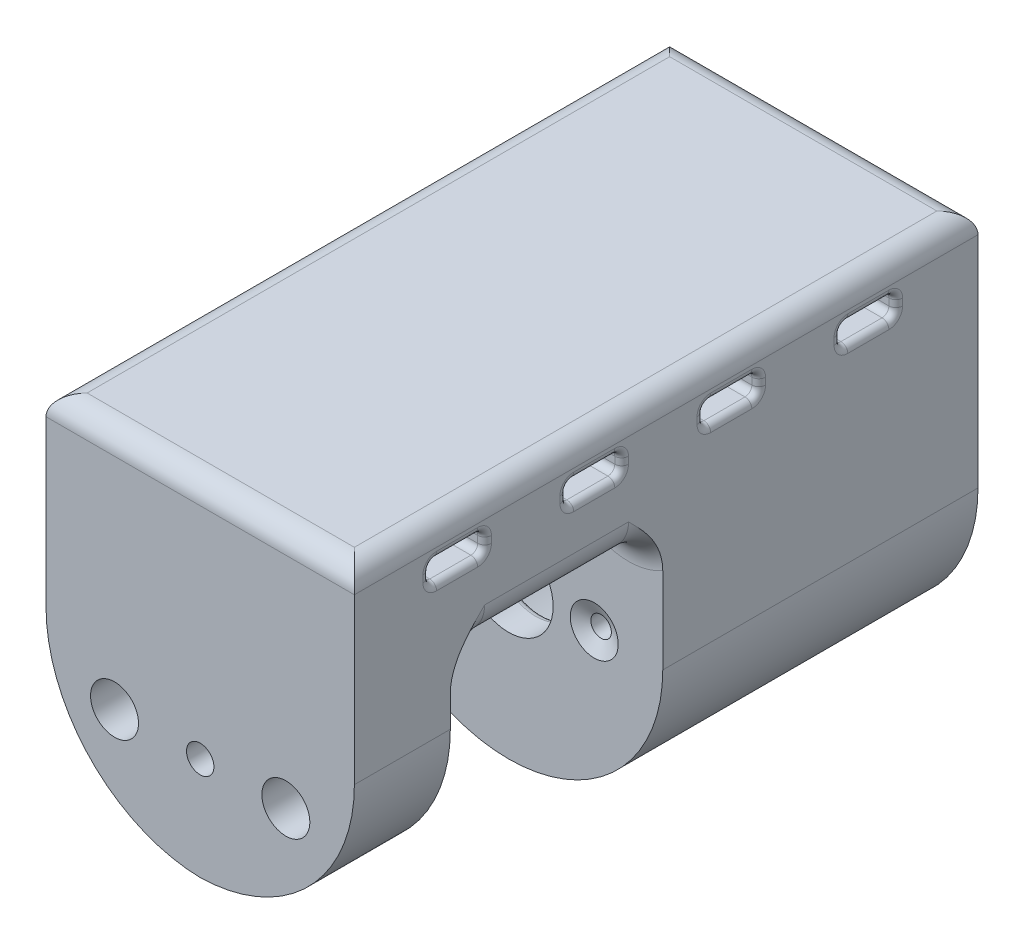
from build123d import *

# Parameters (mm, degrees)
SZKIC1_R                         = 22.5
DODANIE_WYCI_GNI_CIE1_DEPTH      = 5
WYTNIJ_WYCI_GNI_CIE1_REACH       = 34.21
SZKIC2_R                         = 6.5
SZKIC2_R_2                       = 1.5
SFAZOWANIE1_SIZE                 = 2
SFAZOWANIE1_SIZE2                = 1
DODANIE_WYCI_GNI_CIE2_START      = 41
SZKIC4_R                         = 22.5
SZKIC4_R_2                       = 18.7
DODANIE_WYCI_GNI_CIE2_DEPTH      = 41
ZAOKR_GLENIE1_R                  = 1
ZAOKR_GLENIE2_R                  = 1
DODANIE_WYCI_GNI_CIE3_REACH      = 76.118
DODANIE_WYCI_GNI_CIE3_END_RADIUS = 22.5
SZKIC5_W                         = 45
SZKIC5_H                         = 46
DODANIE_WYCI_GNI_CIE4_DEPTH      = 45
SZKIC8_W                         = 45
SZKIC8_H                         = 14
DODANIE_WYCI_GNI_CIE5_DEPTH      = 50
SZKIC10_R                        = 4
WYTNIJ_WYCI_GNI_CIE3_DEPTH       = 10
WYTNIJ_WYCI_GNI_CIE4_REACH       = 98.438
SZKIC11_R                        = 2
ZAOKR_GLENIE5_R                  = 23
ZAOKR_GLENIE6_R                  = 5
WYTNIJ_WYCI_GNI_CIE5_REACH       = 77.829
ZAOKR_GLENIE7_R                  = 1
ZAOKR_GLENIE8_R                  = 3
WYTNIJ_WYCI_GNI_CIE6_REACH       = 102.061
SZKIC13_R                        = 3.5


with BuildPart() as part:
    # Szkic1 → Dodanie-wyciągnięcie1 (new body)
    with BuildSketch(Plane.XY):
        Circle(SZKIC1_R)
    extrude(amount=DODANIE_WYCI_GNI_CIE1_DEPTH)

    # Szkic2 → Wytnij-wyciągnięcie1 (cut, up to next)
    with BuildSketch(Plane.XY.offset(5), mode=Mode.PRIVATE) as wytnij_wyci_gni_cie1_sk1:
        Circle(SZKIC2_R)
    wytnij_wyci_gni_cie1_tool1 = extrude(wytnij_wyci_gni_cie1_sk1.sketch, amount=-WYTNIJ_WYCI_GNI_CIE1_REACH, mode=Mode.PRIVATE) & part.part
    # Szkic2 → Wytnij-wyciągnięcie1 (cut, up to next)
    with BuildSketch(Plane.XY.offset(5), mode=Mode.PRIVATE) as wytnij_wyci_gni_cie1_sk2:
        with Locations((12.5, 0)):
            Circle(SZKIC2_R_2)
    wytnij_wyci_gni_cie1_tool2 = extrude(wytnij_wyci_gni_cie1_sk2.sketch, amount=-WYTNIJ_WYCI_GNI_CIE1_REACH, mode=Mode.PRIVATE) & part.part
    # Szkic2 → Wytnij-wyciągnięcie1 (cut, up to next)
    with BuildSketch(Plane.XY.offset(5), mode=Mode.PRIVATE) as wytnij_wyci_gni_cie1_sk3:
        with Locations((-12.5, 0)):
            Circle(SZKIC2_R_2)
    wytnij_wyci_gni_cie1_tool3 = extrude(wytnij_wyci_gni_cie1_sk3.sketch, amount=-WYTNIJ_WYCI_GNI_CIE1_REACH, mode=Mode.PRIVATE) & part.part
    add(wytnij_wyci_gni_cie1_tool1.solids().sort_by_distance((0, 0, 5))[0], mode=Mode.SUBTRACT)
    add(wytnij_wyci_gni_cie1_tool2.solids().sort_by_distance((12.5, 0, 5))[0], mode=Mode.SUBTRACT)
    add(wytnij_wyci_gni_cie1_tool3.solids().sort_by_distance((-12.5, 0, 5))[0], mode=Mode.SUBTRACT)

    # Sfazowanie1
    sfazowanie1_edges = [part.edges().sort_by_distance(p)[0] for p in [
        (11, 0, 5),
        (-14, 0, 5),
    ]]
    sfazowanie1_side = [part.faces().sort_by_distance(p)[0] for p in [
        (-21.863603897, 0, 5),
    ]]
    chamfer(sfazowanie1_edges, length=SFAZOWANIE1_SIZE, length2=SFAZOWANIE1_SIZE2, reference=sfazowanie1_side[0])

    # Szkic4 → Dodanie-wyciągnięcie2 (add)
    with BuildSketch(Plane(origin=(0, 0, 0), x_dir=(-1, 0, 0), z_dir=(0, 0, -1)).offset(DODANIE_WYCI_GNI_CIE2_START)):
        Circle(SZKIC4_R)
        Circle(SZKIC4_R_2, mode=Mode.SUBTRACT)
    extrude(amount=-DODANIE_WYCI_GNI_CIE2_DEPTH)

    # Zaokrąglenie1
    zaokr_glenie1_edges = [part.edges().sort_by_distance(p)[0] for p in [
        (18.7, 0, 0),
    ]]
    fillet(zaokr_glenie1_edges, radius=ZAOKR_GLENIE1_R)

    # Zaokrąglenie2
    zaokr_glenie2_edges = [part.edges().sort_by_distance(p)[0] for p in [
        (-6.5, 0, 0),
    ]]
    fillet(zaokr_glenie2_edges, radius=ZAOKR_GLENIE2_R)

    # Dodanie-wyciągnięcie3: up to this cylinder (the profile starts outside it)
    dodanie_wyci_gni_cie3_end = Plane(origin=(0, 0, -18), z_dir=(0, 0, -1)) * Cylinder(DODANIE_WYCI_GNI_CIE3_END_RADIUS, 198.236, mode=Mode.PRIVATE)
    # Szkic5 → Dodanie-wyciągnięcie3 (add, up to the surface)
    with BuildSketch(Plane(origin=(0, 35, 0), x_dir=(1, 0, 0), z_dir=(0, 1, 0)), mode=Mode.PRIVATE) as dodanie_wyci_gni_cie3_sk1:
        with Locations((0, 18)):
            Rectangle(SZKIC5_W, SZKIC5_H)
    dodanie_wyci_gni_cie3_tool1 = extrude(dodanie_wyci_gni_cie3_sk1.sketch, amount=-DODANIE_WYCI_GNI_CIE3_REACH, mode=Mode.PRIVATE) - dodanie_wyci_gni_cie3_end
    add(dodanie_wyci_gni_cie3_tool1.solids().sort_by_distance((0, 35, -18))[0])

    # Szkic7 → Dodanie-wyciągnięcie4 (add)
    with BuildSketch(Plane.XY.offset(5)):
        with BuildLine():
            Line((-22.5, 21.213203436), (-22.5, 35))
            Line((-22.5, 35), (22.5, 35))
            Line((22.5, 35), (22.5, 21.213203436))
            ThreePointArc((22.5, 21.213203436), (19.632007164, 16.690533267), (14.318181818, 17.356257356))
            ThreePointArc((14.318181818, 17.356257356), (0, 22.5), (-14.318181818, 17.356257356))
            ThreePointArc((-14.318181818, 17.356257356), (-19.632007164, 16.690533267), (-22.5, 21.213203436))
        make_face()
    extrude(amount=DODANIE_WYCI_GNI_CIE4_DEPTH)

    # Szkic8 → Dodanie-wyciągnięcie5 (add)
    with BuildSketch(Plane(origin=(0, 35, 0), x_dir=(1, 0, 0), z_dir=(0, 1, 0))):
        with Locations((0, -43)):
            Rectangle(SZKIC8_W, SZKIC8_H)
    extrude(amount=-DODANIE_WYCI_GNI_CIE5_DEPTH)

    # Szkic10 → Wytnij-wyciągnięcie3 (cut)
    with BuildSketch(Plane(origin=(0, 0, 36), x_dir=(-1, 0, 0), z_dir=(0, 0, -1))):
        Circle(SZKIC10_R)
    extrude(amount=-WYTNIJ_WYCI_GNI_CIE3_DEPTH, mode=Mode.SUBTRACT)

    # Szkic11 → Wytnij-wyciągnięcie4 (cut, up to next)
    with BuildSketch(Plane(origin=(0, 0, 46), x_dir=(-1, 0, 0), z_dir=(0, 0, -1)), mode=Mode.PRIVATE) as wytnij_wyci_gni_cie4_sk1:
        Circle(SZKIC11_R)
    wytnij_wyci_gni_cie4_tool1 = extrude(wytnij_wyci_gni_cie4_sk1.sketch, amount=-WYTNIJ_WYCI_GNI_CIE4_REACH, mode=Mode.PRIVATE) & part.part
    add(wytnij_wyci_gni_cie4_tool1.solids().sort_by_distance((0, 0, 46))[0], mode=Mode.SUBTRACT)

    # Zaokrąglenie5
    # the kernel refuses this fillet: 23 mm, written as the material it takes off along each edge
    with BuildSketch(Plane(origin=(-22.5, -15, 36), x_dir=(0, 1, 0), z_dir=(0, 0, 1)), Plane(origin=(22.5, -15, 107.5), x_dir=(0, 1, 0), z_dir=(0, 0, -1))) as zaokr_glenie5_piece_1:
        with BuildLine():
            CenterArc((ZAOKR_GLENIE5_R, -ZAOKR_GLENIE5_R), ZAOKR_GLENIE5_R, 90, 90)
            Line((0, -ZAOKR_GLENIE5_R), (0, 0))
            Line((0, 0), (ZAOKR_GLENIE5_R, 0))
        make_face()
    extrude(amount=71.5, mode=Mode.SUBTRACT)

    # Zaokrąglenie6
    # the kernel refuses this fillet: 5 mm, written as the material it adds along each edge
    with BuildSketch(Plane(origin=(-17.5, 21.213203436, 5), x_dir=(0.6363636363636366, -0.7713892158398699, 0), z_dir=(0.7713892158398699, 0.6363636363636366, 0))) as zaokr_glenie6_piece_1_section:
        with BuildLine():
            CenterArc((5 + ZAOKR_GLENIE6_R, -ZAOKR_GLENIE6_R), ZAOKR_GLENIE6_R, 90, 90)
            Line((5, -ZAOKR_GLENIE6_R), (5, 0))
            Line((5, 0), (5 + ZAOKR_GLENIE6_R, 0))
        make_face()
    zaokr_glenie6_piece_1 = revolve(axis=Axis((-17.5, 21.213203436, 5), (0, 0, -1)), revolution_arc=272.879851872, mode=Mode.PRIVATE)
    zaokr_glenie6_piece_1 = split(zaokr_glenie6_piece_1, bisect_by=Plane(origin=(-22.5, 15.199925606, 5.801940189), z_dir=(1, 0, 0)), keep=Keep.TOP, mode=Mode.PRIVATE)
    add(zaokr_glenie6_piece_1)
    with BuildSketch(Plane(origin=(0, 0, 5), x_dir=(0.6363636363636364, 0.7713892158398701, 0), z_dir=(0.7713892158398701, -0.6363636363636364, 0))) as zaokr_glenie6_piece_2:
        with BuildLine():
            CenterArc((22.5 - ZAOKR_GLENIE6_R, ZAOKR_GLENIE6_R), ZAOKR_GLENIE6_R, 270, 90)
            Line((22.5, ZAOKR_GLENIE6_R), (22.5, 0))
            Line((22.5, 0), (22.5 - ZAOKR_GLENIE6_R, 0))
        make_face()
    revolve(axis=Axis((0, 0, 5), (0, 0, 1)), revolution_arc=79.042392717)
    with BuildSketch(Plane(origin=(17.5, 21.213203436, 5), x_dir=(-0.8023870318787292, 0.5968040307109557, 0), z_dir=(-0.5968040307109557, -0.8023870318787292, 0))) as zaokr_glenie6_piece_3_section:
        with BuildLine():
            CenterArc((5 + ZAOKR_GLENIE6_R, -ZAOKR_GLENIE6_R), ZAOKR_GLENIE6_R, 90, 90)
            Line((5, -ZAOKR_GLENIE6_R), (5, 0))
            Line((5, 0), (5 + ZAOKR_GLENIE6_R, 0))
        make_face()
    zaokr_glenie6_piece_3 = revolve(axis=Axis((17.5, 21.213203436, 5), (0, 0, -1)), revolution_arc=272.879851872, mode=Mode.PRIVATE)
    zaokr_glenie6_piece_3 = split(zaokr_glenie6_piece_3, bisect_by=Plane(origin=(22.5, 16.181434174, 6.246968643), z_dir=(-1, 0, 0)), keep=Keep.TOP, mode=Mode.PRIVATE)
    add(zaokr_glenie6_piece_3)
    with BuildSketch(Plane(origin=(17.5, 21.213203436, 36), x_dir=(-0.8023870318787292, 0.5968040307109557, 0), z_dir=(-0.5968040307109557, -0.8023870318787292, 0))) as zaokr_glenie6_piece_4_section:
        with BuildLine():
            CenterArc((5 + ZAOKR_GLENIE6_R, ZAOKR_GLENIE6_R), ZAOKR_GLENIE6_R, 180, 90)
            Line((5 + ZAOKR_GLENIE6_R, 0), (5, 0))
            Line((5, 0), (5, ZAOKR_GLENIE6_R))
        make_face()
    zaokr_glenie6_piece_4 = revolve(axis=Axis((17.5, 21.213203436, 36), (0, 0, -1)), revolution_arc=272.879851872, mode=Mode.PRIVATE)
    zaokr_glenie6_piece_4 = split(zaokr_glenie6_piece_4, bisect_by=Plane(origin=(22.5, 16.181434399, 34.753031202), z_dir=(-1, 0, 0)), keep=Keep.TOP, mode=Mode.PRIVATE)
    add(zaokr_glenie6_piece_4)
    with BuildSketch(Plane(origin=(0, 0, 36), x_dir=(-0.6363636363636367, 0.7713892158398697, 0), z_dir=(-0.7713892158398697, -0.6363636363636367, 0))) as zaokr_glenie6_piece_5:
        with BuildLine():
            CenterArc((22.5 - ZAOKR_GLENIE6_R, ZAOKR_GLENIE6_R), ZAOKR_GLENIE6_R, 270, 90)
            Line((22.5 - ZAOKR_GLENIE6_R, 0), (22.5, 0))
            Line((22.5, 0), (22.5, ZAOKR_GLENIE6_R))
        make_face()
    revolve(axis=Axis((0, 0, 36), (0, 0, -1)), revolution_arc=79.042392717)
    with BuildSketch(Plane(origin=(-17.5, 21.213203436, 36), x_dir=(0.6363636363636366, -0.7713892158398699, 0), z_dir=(0.7713892158398699, 0.6363636363636366, 0))) as zaokr_glenie6_piece_6_section:
        with BuildLine():
            CenterArc((5 + ZAOKR_GLENIE6_R, ZAOKR_GLENIE6_R), ZAOKR_GLENIE6_R, 180, 90)
            Line((5 + ZAOKR_GLENIE6_R, 0), (5, 0))
            Line((5, 0), (5, ZAOKR_GLENIE6_R))
        make_face()
    zaokr_glenie6_piece_6 = revolve(axis=Axis((-17.5, 21.213203436, 36), (0, 0, -1)), revolution_arc=272.879851872, mode=Mode.PRIVATE)
    zaokr_glenie6_piece_6 = split(zaokr_glenie6_piece_6, bisect_by=Plane(origin=(-22.5, 16.181437039, 34.753031529), z_dir=(1, 0, 0)), keep=Keep.TOP, mode=Mode.PRIVATE)
    add(zaokr_glenie6_piece_6)

    # Szkic12 → Wytnij-wyciągnięcie5 (cut, up to next)
    with BuildSketch(Plane(origin=(22.5, 0, 0), x_dir=(0, 0, -1), z_dir=(1, 0, 0)), mode=Mode.PRIVATE) as wytnij_wyci_gni_cie5_sk1:
        with BuildLine():
            Line((-38, 30.5), (-32, 30.5))
            ThreePointArc((-32, 30.5), (-31.292893219, 30.207106781), (-31, 29.5))
            Line((-31, 29.5), (-31, 28.5))
            ThreePointArc((-31, 28.5), (-31.292893219, 27.792893219), (-32, 27.5))
            Line((-32, 27.5), (-38, 27.5))
            ThreePointArc((-38, 27.5), (-38.707106781, 27.792893219), (-39, 28.5))
            Line((-39, 28.5), (-39, 29.5))
            ThreePointArc((-39, 29.5), (-38.707106781, 30.207106781), (-38, 30.5))
        make_face()
    wytnij_wyci_gni_cie5_tool1 = extrude(wytnij_wyci_gni_cie5_sk1.sketch, amount=-WYTNIJ_WYCI_GNI_CIE5_REACH, mode=Mode.PRIVATE) & part.part
    # Szkic12 → Wytnij-wyciągnięcie5 (cut, up to next)
    with BuildSketch(Plane(origin=(22.5, 0, 0), x_dir=(0, 0, -1), z_dir=(1, 0, 0)), mode=Mode.PRIVATE) as wytnij_wyci_gni_cie5_sk2:
        with BuildLine():
            Line((-19, 29.5), (-19, 28.5))
            ThreePointArc((-19, 28.5), (-18.707106781, 27.792893219), (-18, 27.5))
            Line((-18, 27.5), (-12, 27.5))
            ThreePointArc((-12, 27.5), (-11.292893219, 27.792893219), (-11, 28.5))
            Line((-11, 28.5), (-11, 29.5))
            ThreePointArc((-11, 29.5), (-11.292893219, 30.207106781), (-12, 30.5))
            Line((-12, 30.5), (-18, 30.5))
            ThreePointArc((-18, 30.5), (-18.707106781, 30.207106781), (-19, 29.5))
        make_face()
    wytnij_wyci_gni_cie5_tool2 = extrude(wytnij_wyci_gni_cie5_sk2.sketch, amount=-WYTNIJ_WYCI_GNI_CIE5_REACH, mode=Mode.PRIVATE) & part.part
    # Szkic12 → Wytnij-wyciągnięcie5 (cut, up to next)
    with BuildSketch(Plane(origin=(22.5, 0, 0), x_dir=(0, 0, -1), z_dir=(1, 0, 0)), mode=Mode.PRIVATE) as wytnij_wyci_gni_cie5_sk3:
        with BuildLine():
            Line((1, 29.5), (1, 28.5))
            ThreePointArc((1, 28.5), (1.292893219, 27.792893219), (2, 27.5))
            Line((2, 27.5), (8, 27.5))
            ThreePointArc((8, 27.5), (8.707106781, 27.792893219), (9, 28.5))
            Line((9, 28.5), (9, 29.5))
            ThreePointArc((9, 29.5), (8.707106781, 30.207106781), (8, 30.5))
            Line((8, 30.5), (2, 30.5))
            ThreePointArc((2, 30.5), (1.292893219, 30.207106781), (1, 29.5))
        make_face()
    wytnij_wyci_gni_cie5_tool3 = extrude(wytnij_wyci_gni_cie5_sk3.sketch, amount=-WYTNIJ_WYCI_GNI_CIE5_REACH, mode=Mode.PRIVATE) & part.part
    # Szkic12 → Wytnij-wyciągnięcie5 (cut, up to next)
    with BuildSketch(Plane(origin=(22.5, 0, 0), x_dir=(0, 0, -1), z_dir=(1, 0, 0)), mode=Mode.PRIVATE) as wytnij_wyci_gni_cie5_sk4:
        with BuildLine():
            Line((21, 29.5), (21, 28.5))
            ThreePointArc((21, 28.5), (21.292893219, 27.792893219), (22, 27.5))
            Line((22, 27.5), (28, 27.5))
            ThreePointArc((28, 27.5), (28.707106781, 27.792893219), (29, 28.5))
            Line((29, 28.5), (29, 29.5))
            ThreePointArc((29, 29.5), (28.707106781, 30.207106781), (28, 30.5))
            Line((28, 30.5), (22, 30.5))
            ThreePointArc((22, 30.5), (21.292893219, 30.207106781), (21, 29.5))
        make_face()
    wytnij_wyci_gni_cie5_tool4 = extrude(wytnij_wyci_gni_cie5_sk4.sketch, amount=-WYTNIJ_WYCI_GNI_CIE5_REACH, mode=Mode.PRIVATE) & part.part
    add(wytnij_wyci_gni_cie5_tool1.solids().sort_by_distance((22.5, 29, 35))[0], mode=Mode.SUBTRACT)
    add(wytnij_wyci_gni_cie5_tool2.solids().sort_by_distance((22.5, 29, 15))[0], mode=Mode.SUBTRACT)
    add(wytnij_wyci_gni_cie5_tool3.solids().sort_by_distance((22.5, 29, -5))[0], mode=Mode.SUBTRACT)
    add(wytnij_wyci_gni_cie5_tool4.solids().sort_by_distance((22.5, 29, -25))[0], mode=Mode.SUBTRACT)

    # Zaokrąglenie7
    zaokr_glenie7_edges = [part.edges().sort_by_distance(p)[0] for p in [
        (-22.5, 27.792893219, 38.707106781),
        (-22.5, 29, 39),
        (-22.5, 30.207106781, 38.707106781),
        (-22.5, 30.5, 35),
        (-22.5, 30.207106781, 31.292893219),
        (-22.5, 29, 31),
        (-22.5, 27.792893219, 31.292893219),
        (-22.5, 27.5, 35),
        (22.5, 27.792893219, 38.707106781),
        (22.5, 27.5, 35),
        (22.5, 27.792893219, 31.292893219),
        (22.5, 29, 31),
        (22.5, 30.207106781, 31.292893219),
        (22.5, 30.5, 35),
        (22.5, 30.207106781, 38.707106781),
        (22.5, 29, 39),
        (-22.5, 27.792893219, 18.707106781),
        (-22.5, 29, 19),
        (-22.5, 30.207106781, 18.707106781),
        (-22.5, 30.5, 15),
        (-22.5, 30.207106781, 11.292893219),
        (-22.5, 29, 11),
        (-22.5, 27.792893219, 11.292893219),
        (-22.5, 27.5, 15),
        (22.5, 27.792893219, 18.707106781),
        (22.5, 27.5, 15),
        (22.5, 27.792893219, 11.292893219),
        (22.5, 29, 11),
        (22.5, 30.207106781, 11.292893219),
        (22.5, 30.5, 15),
        (22.5, 30.207106781, 18.707106781),
        (22.5, 29, 19),
        (-22.5, 27.792893219, -1.292893219),
        (-22.5, 29, -1),
        (-22.5, 30.207106781, -1.292893219),
        (-22.5, 30.5, -5),
        (-22.5, 30.207106781, -8.707106781),
        (-22.5, 29, -9),
        (-22.5, 27.792893219, -8.707106781),
        (-22.5, 27.5, -5),
        (22.5, 27.792893219, -1.292893219),
        (22.5, 27.5, -5),
        (22.5, 27.792893219, -8.707106781),
        (22.5, 29, -9),
        (22.5, 30.207106781, -8.707106781),
        (22.5, 30.5, -5),
        (22.5, 30.207106781, -1.292893219),
        (22.5, 29, -1),
        (-22.5, 27.792893219, -21.292893219),
        (-22.5, 29, -21),
        (-22.5, 30.207106781, -21.292893219),
        (-22.5, 30.5, -25),
        (-22.5, 30.207106781, -28.707106781),
        (-22.5, 29, -29),
        (-22.5, 27.792893219, -28.707106781),
        (-22.5, 27.5, -25),
        (22.5, 27.792893219, -21.292893219),
        (22.5, 27.5, -25),
        (22.5, 27.792893219, -28.707106781),
        (22.5, 29, -29),
        (22.5, 30.207106781, -28.707106781),
        (22.5, 30.5, -25),
        (22.5, 30.207106781, -21.292893219),
        (22.5, 29, -21),
    ]]
    fillet(zaokr_glenie7_edges, radius=ZAOKR_GLENIE7_R)

    # Zaokrąglenie8
    zaokr_glenie8_edges = [part.edges().sort_by_distance(p)[0] for p in [
        (-22.5, 35, 4.5),
        (22.5, 35, 4.5),
        (0, 35, -41),
        (0, 35, 50),
    ]]
    fillet(zaokr_glenie8_edges, radius=ZAOKR_GLENIE8_R)

    # Szkic13 → Wytnij-wyciągnięcie6 (cut, up to next)
    with BuildSketch(Plane.XY.offset(50), mode=Mode.PRIVATE) as wytnij_wyci_gni_cie6_sk1:
        with Locations((12.5, 0)):
            Circle(SZKIC13_R)
    wytnij_wyci_gni_cie6_tool1 = extrude(wytnij_wyci_gni_cie6_sk1.sketch, amount=-WYTNIJ_WYCI_GNI_CIE6_REACH, mode=Mode.PRIVATE) & part.part
    # Szkic13 → Wytnij-wyciągnięcie6 (cut, up to next)
    with BuildSketch(Plane.XY.offset(50), mode=Mode.PRIVATE) as wytnij_wyci_gni_cie6_sk2:
        with Locations((-12.5, 0)):
            Circle(SZKIC13_R)
    wytnij_wyci_gni_cie6_tool2 = extrude(wytnij_wyci_gni_cie6_sk2.sketch, amount=-WYTNIJ_WYCI_GNI_CIE6_REACH, mode=Mode.PRIVATE) & part.part
    add(wytnij_wyci_gni_cie6_tool1.solids().sort_by_distance((12.5, 0, 50))[0], mode=Mode.SUBTRACT)
    add(wytnij_wyci_gni_cie6_tool2.solids().sort_by_distance((-12.5, 0, 50))[0], mode=Mode.SUBTRACT)


solid = part.part
